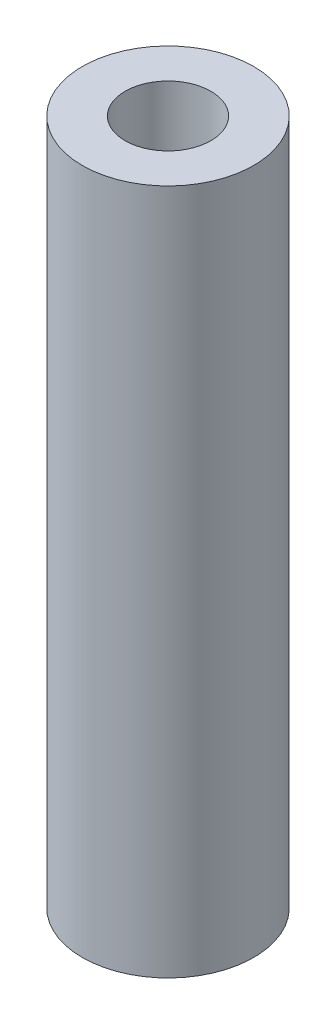
from build123d import *

# Parameters (mm, degrees)
SKETCH1_R           = 2.5
SKETCH1_R_2         = 1.25
BOSS_EXTRUDE1_DEPTH = 20


with BuildPart() as part:
    # Sketch1 → Boss-Extrude1 (new body)
    with BuildSketch(Plane(origin=(0, 0, 0), x_dir=(1, 0, 0), z_dir=(0, 1, 0))):
        Circle(SKETCH1_R)
        Circle(SKETCH1_R_2, mode=Mode.SUBTRACT)
    extrude(amount=BOSS_EXTRUDE1_DEPTH)


solid = part.part
